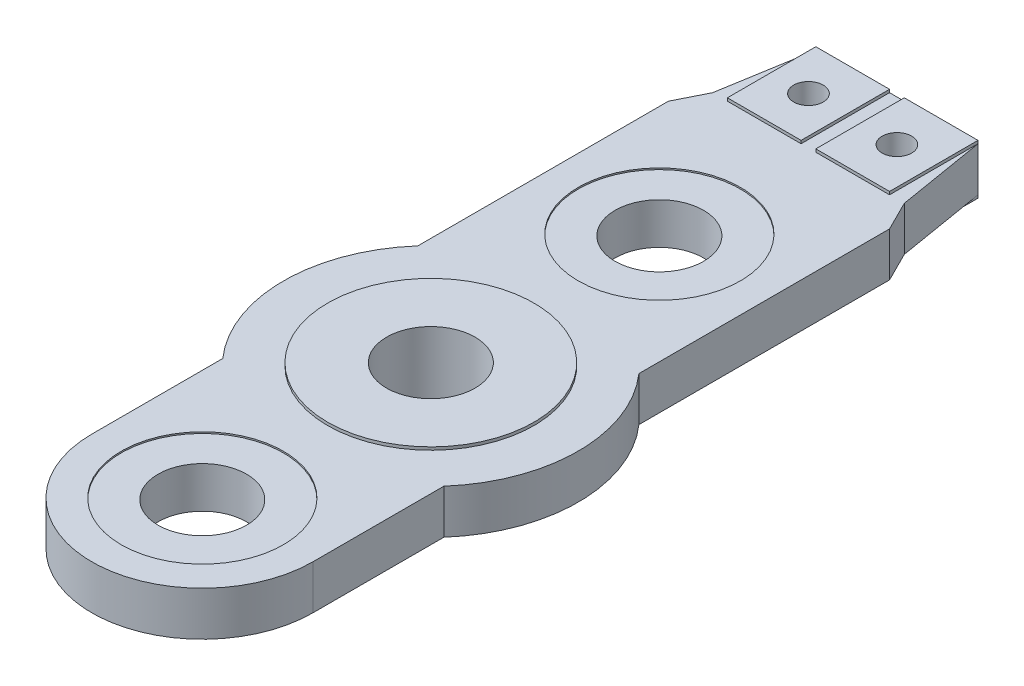
from build123d import *

# Parameters (mm, degrees)
SKETCH1_R           = 1.5
SKETCH1_R_2         = 0.5
BOSS_EXTRUDE1_DEPTH = 1.5
SKETCH2_R           = 3.5
SKETCH2_R_2         = 1.5
BOSS_EXTRUDE2_DEPTH = 0.1
SKETCH3_R           = 2.75
CUT_EXTRUDE1_DEPTH  = 0.05
CUT_EXTRUDE2_START  = -0.05
SKETCH4_R           = 2.75
CUT_EXTRUDE2_DEPTH  = 0.05
BOSS_EXTRUDE3_START = 1.5
SKETCH5_R           = 2.75
SKETCH5_R_2         = 1.5
BOSS_EXTRUDE3_DEPTH = 1.5
FILLET1_R           = 0.5
SKETCH6_W           = 2.5
SKETCH6_H           = 3
SKETCH6_R           = 0.5
BOSS_EXTRUDE4_DEPTH = 0.1
BOSS_EXTRUDE5_START = 0.1
SKETCH7_W           = 2.5
SKETCH7_H           = 3
SKETCH7_R           = 0.5
BOSS_EXTRUDE5_DEPTH = 0.1


with BuildPart() as part:
    # Sketch1 → Boss-Extrude1 (new body)
    with BuildSketch(Plane(origin=(0, 0, 0), x_dir=(1, 0, 0), z_dir=(0, 1, 0))):
        with BuildLine():
            Line((-3.75, -7.75), (-3.75, -3.307189139))
            ThreePointArc((-3.75, -3.307189139), (-5, 0), (-3.75, 3.307189139))
            Line((-3.75, 3.307189139), (-3.75, 11.807189139))
            Line((-3.75, 11.807189139), (-3.25, 12.807189139))
            Line((-3.25, 12.807189139), (-2.75, 15.807189139))
            Line((-2.75, 15.807189139), (2.75, 15.807189139))
            Line((2.75, 15.807189139), (3.25, 12.807189139))
            Line((3.25, 12.807189139), (3.75, 11.807189139))
            Line((3.75, 11.807189139), (3.75, 3.307189139))
            ThreePointArc((3.75, 3.307189139), (5, 0), (3.75, -3.307189139))
            Line((3.75, -3.307189139), (3.75, -7.75))
            ThreePointArc((3.75, -7.75), (0, -11.5), (-3.75, -7.75))
        make_face()
        with Locations((0, -7.75)):
            Circle(SKETCH1_R, mode=Mode.SUBTRACT)
        with Locations((0, 7.75)):
            Circle(SKETCH1_R, mode=Mode.SUBTRACT)
        with Locations((-1.5, 14.307189139)):
            Circle(SKETCH1_R_2, mode=Mode.SUBTRACT)
        with Locations((1.5, 14.307189139)):
            Circle(SKETCH1_R_2, mode=Mode.SUBTRACT)
        Circle(SKETCH1_R, mode=Mode.SUBTRACT)
    extrude(amount=BOSS_EXTRUDE1_DEPTH)

    # Sketch2 → Boss-Extrude2 (add)
    with BuildSketch(Plane(origin=(0, 1.5, 0), x_dir=(1, 0, 0), z_dir=(0, 1, 0))):
        Circle(SKETCH2_R)
        Circle(SKETCH2_R_2, mode=Mode.SUBTRACT)
    extrude(amount=BOSS_EXTRUDE2_DEPTH)

    # Sketch3 → Cut-Extrude1 (cut)
    with BuildSketch(Plane(origin=(0, 1.5, 0), x_dir=(1, 0, 0), z_dir=(0, 1, 0))):
        with Locations((0, -7.75)):
            Circle(SKETCH3_R)
        with Locations((0, 7.75)):
            Circle(SKETCH3_R)
    extrude(amount=-CUT_EXTRUDE1_DEPTH, mode=Mode.SUBTRACT)

    # Sketch4 → Cut-Extrude2 (cut)
    with BuildSketch(Plane.XZ.offset(CUT_EXTRUDE2_START)):
        with Locations((0, -7.75)):
            Circle(SKETCH4_R)
        with Locations((0, 7.75)):
            Circle(SKETCH4_R)
    extrude(amount=CUT_EXTRUDE2_DEPTH, mode=Mode.SUBTRACT)

    # Sketch5 → Boss-Extrude3 (add)
    with BuildSketch(Plane.XZ.offset(BOSS_EXTRUDE3_START)):
        Circle(SKETCH5_R)
        Circle(SKETCH5_R_2, mode=Mode.SUBTRACT)
    extrude(amount=-BOSS_EXTRUDE3_DEPTH)

    # Fillet1
    fillet1_edges = [part.edges().sort_by_distance(p)[0] for p in [
        (-2.75, 0, 0),
    ]]
    fillet(fillet1_edges, radius=FILLET1_R)

    # Sketch6 → Boss-Extrude4 (add)
    # profile 1 of 2: a face of its own
    with BuildSketch(Plane(origin=(0, 1.5, 0), x_dir=(1, 0, 0), z_dir=(0, 1, 0))):
        with Locations((-1.5, 14.307189139)):
            Rectangle(SKETCH6_W, SKETCH6_H)
        with Locations((-1.5, 14.307189139)):
            Circle(SKETCH6_R, mode=Mode.SUBTRACT)
    # profile 2 of 2: a face of its own
    with BuildSketch(Plane(origin=(0, 1.5, 0), x_dir=(1, 0, 0), z_dir=(0, 1, 0))):
        with Locations((1.5, 14.307189139)):
            Rectangle(SKETCH6_W, SKETCH6_H)
        with Locations((1.5, 14.307189139)):
            Circle(SKETCH6_R, mode=Mode.SUBTRACT)
    extrude(amount=BOSS_EXTRUDE4_DEPTH)

    # Sketch7 → Boss-Extrude5 (add)
    # profile 1 of 2: a face of its own
    with BuildSketch(Plane.XZ.offset(BOSS_EXTRUDE5_START)):
        with Locations((-1.5, -14.307189139)):
            Rectangle(SKETCH7_W, SKETCH7_H)
        with Locations((-1.5, -14.307189139)):
            Circle(SKETCH7_R, mode=Mode.SUBTRACT)
    # profile 2 of 2: a face of its own
    with BuildSketch(Plane.XZ.offset(BOSS_EXTRUDE5_START)):
        with Locations((1.5, -14.307189139)):
            Rectangle(SKETCH7_W, SKETCH7_H)
        with Locations((1.5, -14.307189139)):
            Circle(SKETCH7_R, mode=Mode.SUBTRACT)
    extrude(amount=-BOSS_EXTRUDE5_DEPTH)


solid = part.part
